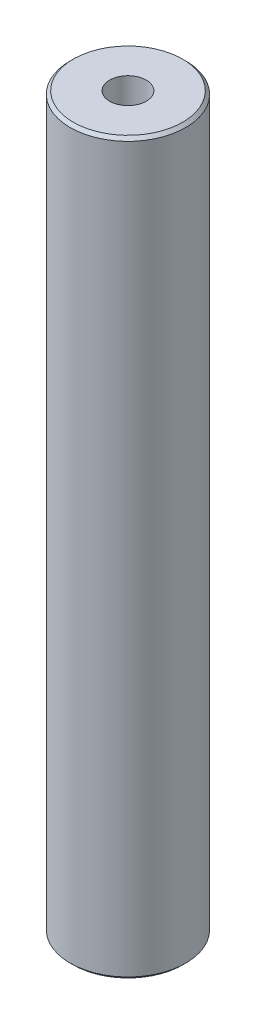
from build123d import *

# Parameters (mm, degrees)
SKETCH1_R           = 47.5
BOSS_EXTRUDE1_DEPTH = 600
SKETCH2_R           = 15.075145813
CUT_EXTRUDE1_DEPTH  = 604.748706003
CHAMFER1_SIZE       = 2.529761766


with BuildPart() as part:
    # Sketch1 → Boss-Extrude1 (new body)
    with BuildSketch(Plane(origin=(0, 0, 0), x_dir=(1, 0, 0), z_dir=(0, 1, 0))):
        Circle(SKETCH1_R)
    extrude(amount=BOSS_EXTRUDE1_DEPTH)

    # Sketch2 → Cut-Extrude1 (cut, through all)
    with BuildSketch(Plane(origin=(0, 0, 0), x_dir=(1, 0, 0), z_dir=(0, 1, 0))):
        Circle(SKETCH2_R)
    extrude(amount=CUT_EXTRUDE1_DEPTH, mode=Mode.SUBTRACT)

    # Chamfer1
    chamfer1_edges = [part.edges().sort_by_distance(p)[0] for p in [
        (-47.5, 600, 0),
        (-47.5, 0, 0),
    ]]
    chamfer(chamfer1_edges, length=CHAMFER1_SIZE)


solid = part.part
